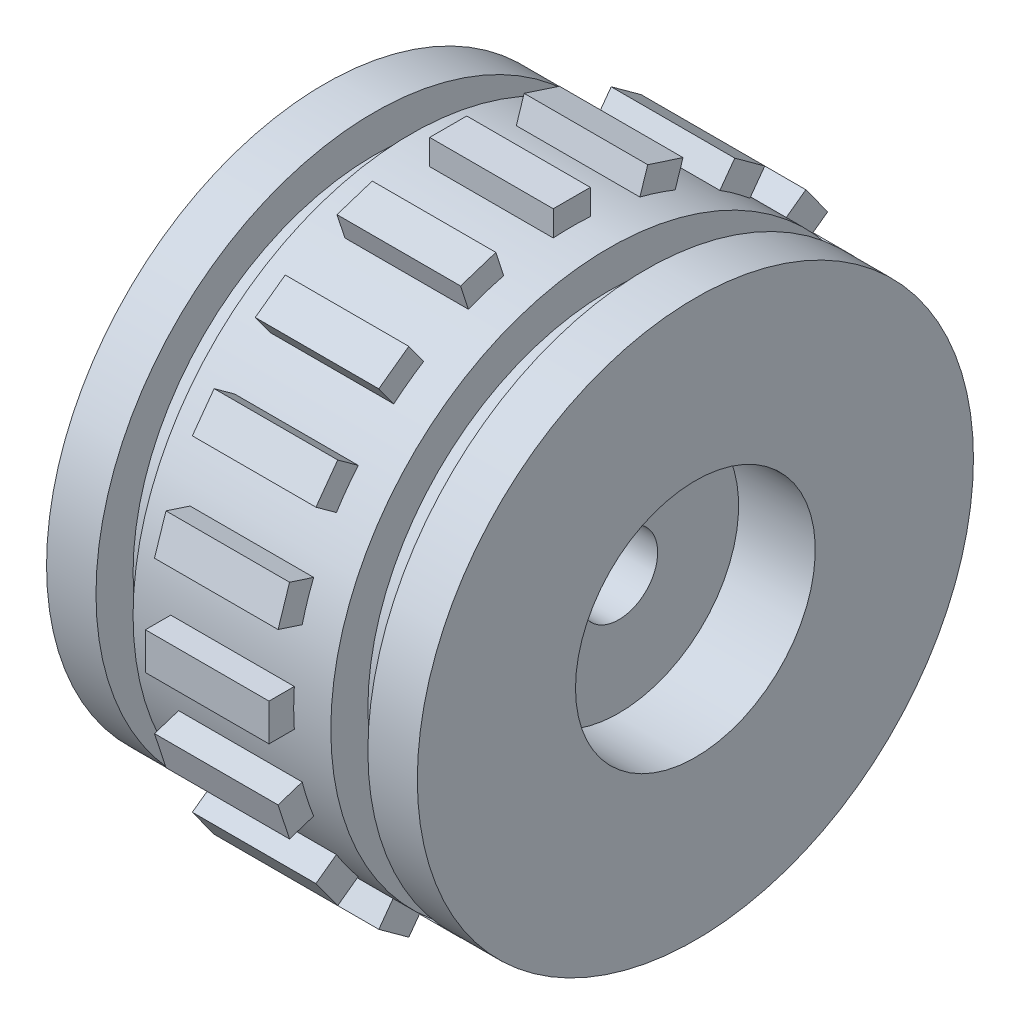
from build123d import *

# Parameters (mm, degrees)
CHAMFER_2_SIZE           = 2
SKETCH_6_W               = 3
SKETCH_6_H               = 4
SKETCH_7_W               = 10
SKETCH_7_H               = 3.436723268
EXTRUDE_1_DEPTH          = 1.5
PATTERN_CIRCULAR_1_COUNT = 20


with BuildPart() as part:
    # Эскиз4 → Повернуть1 (revolve)
    with BuildSketch(Plane.XY):
        Polygon((0, 22.5), (-30, 22.5), (-30, 18.5), (-19, 18.5), (-19, 5.15), (-13, 5.15), (-13, 3.15), (-6.2, 3.15), (-6.2, 9.7), (0, 9.7), align=None)
    revolve(axis=Axis((-30, 0, 0), (1, 0, 0)))

    # Фаска2
    chamfer_2_edges = [part.edges().sort_by_distance(p)[0] for p in [
        (-30, -18.5, 0),
        (-19, -18.5, 0),
    ]]
    chamfer(chamfer_2_edges, length=CHAMFER_2_SIZE)

    # Эскиз6 → Вырез-Повернуть2 (revolve, cut)
    with BuildSketch(Plane.XY):
        with Locations((-24.5, 21.5)):
            Rectangle(SKETCH_6_W, SKETCH_6_H)
        with Locations((-5.5, 21.5)):
            Rectangle(SKETCH_6_W, SKETCH_6_H)
    revolve(axis=Axis((-30, 0, 0), (1, 0, 0)), mode=Mode.SUBTRACT)

    # Эскиз7 → Бобышка-Вытянуть1 (add, symmetric)
    with BuildSketch(Plane.XY):
        with Locations((-15, 22.781638366)):
            Rectangle(SKETCH_7_W, SKETCH_7_H)
    extrude_1 = extrude(amount=EXTRUDE_1_DEPTH, both=True)

    # Круговой массив1: Бобышка-Вытянуть1 ×20 about axis
    pattern_circular_1_axis = Axis((-30, 0, 0), (-1, 0, 0))
    for i in range(1, PATTERN_CIRCULAR_1_COUNT):
        add(extrude_1.rotate(pattern_circular_1_axis, i * 360 / PATTERN_CIRCULAR_1_COUNT))


solid = part.part
